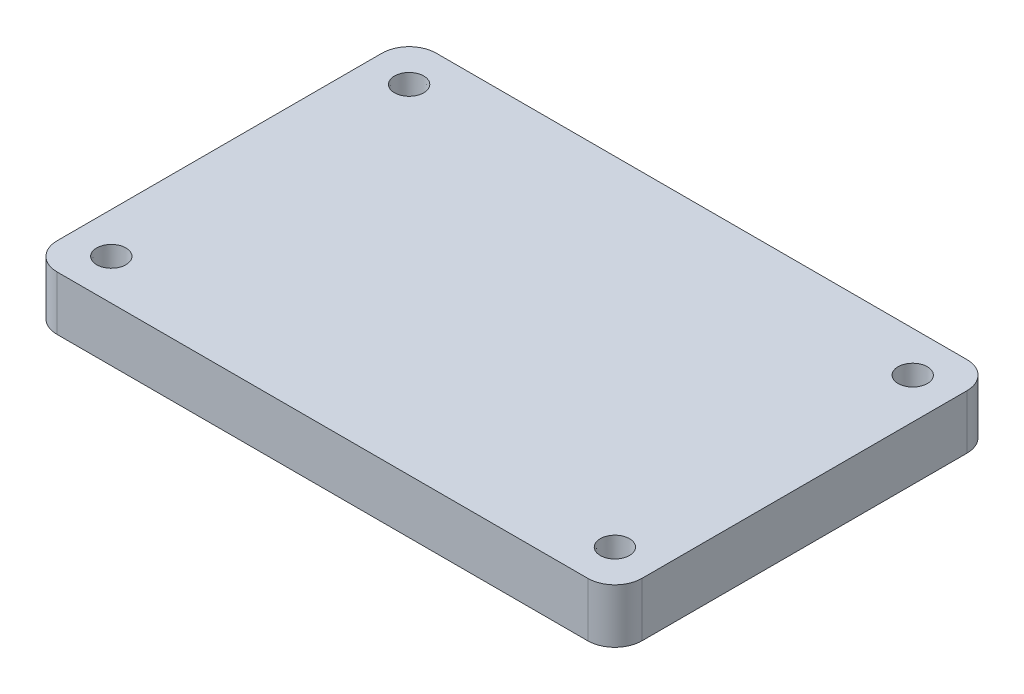
from build123d import *
from OCP.BRepFilletAPI import BRepFilletAPI_MakeChamfer

# Parameters (mm, degrees)
SKETCH1_W           = 108
SKETCH1_H           = 70
BOSS_EXTRUDE1_DEPTH = 10
HOLE1_D             = 4.8
HOLE1_DEPTH         = 8
HOLE1_CBORE_D       = 5.4
HOLE1_CBORE_DEPTH   = 6
FILLET1_R           = 5
HOLE3_D             = 4.8
HOLE3_DEPTH         = 8
HOLE3_CBORE_D       = 5.4
HOLE3_CBORE_DEPTH   = 6
CHAMFER1_SIZE       = 6
CHAMFER1_SIZE_2     = 0.3


with BuildPart() as part:
    # Sketch1 → Boss-Extrude1 (new body)
    with BuildSketch(Plane(origin=(0, 0, 0), x_dir=(1, 0, 0), z_dir=(0, 1, 0))):
        Rectangle(SKETCH1_W, SKETCH1_H)
    extrude(amount=BOSS_EXTRUDE1_DEPTH)

    # Hole1
    with Locations(Plane(origin=(0, 10, 0), x_dir=(1, 0, 0), z_dir=(0, 1, 0))):
        with Locations((46.5, 27.5), (-46.5, 27.5), (-46.5, -27.5), (46.5, -27.5)):
            CounterBoreHole(HOLE1_D / 2, HOLE1_CBORE_D / 2, HOLE1_CBORE_DEPTH, depth=HOLE1_DEPTH)

    # Fillet1
    fillet1_edges = [part.edges().sort_by_distance(p)[0] for p in [
        (54, 5, 35),
        (-54, 5, 35),
        (-54, 5, -35),
        (54, 5, -35),
    ]]
    fillet(fillet1_edges, radius=FILLET1_R)

    # Hole3
    with Locations(Plane(origin=(0, 0, 0), x_dir=(-1, 0, 0), z_dir=(0, -1, 0))):
        with Locations((-20.3, 0), (20.3, 0), (-30, 27.5), (30, 27.5), (30, -27.5), (-30, -27.5)):
            CounterBoreHole(HOLE3_D / 2, HOLE3_CBORE_D / 2, HOLE3_CBORE_DEPTH, depth=HOLE3_DEPTH)

    # Chamfer1
    chamfer1_edges_1 = [part.edges().sort_by_distance(p)[0] for p in [
        (43.8, 4, 27.5),
    ]]
    chamfer1_side_1 = [part.faces().sort_by_distance(p)[0] for p in [
        (43.8, 4.006, 27.5),
    ]]
    chamfer1_edges_2 = [part.edges().sort_by_distance(p)[0] for p in [
        (-49.2, 4, 27.5),
    ]]
    chamfer1_side_2 = [part.faces().sort_by_distance(p)[0] for p in [
        (-49.2, 4.006, 27.5),
    ]]
    chamfer1_edges_3 = [part.edges().sort_by_distance(p)[0] for p in [
        (-49.2, 4, -27.5),
    ]]
    chamfer1_side_3 = [part.faces().sort_by_distance(p)[0] for p in [
        (-49.2, 4.006, -27.5),
    ]]
    chamfer1_edges_4 = [part.edges().sort_by_distance(p)[0] for p in [
        (43.8, 4, -27.5),
    ]]
    chamfer1_side_4 = [part.faces().sort_by_distance(p)[0] for p in [
        (43.8, 4.006, -27.5),
    ]]
    chamfer1_edges_5 = [part.edges().sort_by_distance(p)[0] for p in [
        (32.7, 6, 27.5),
    ]]
    chamfer1_side_5 = [part.faces().sort_by_distance(p)[0] for p in [
        (32.7, 5.994, 27.5),
    ]]
    chamfer1_edges_6 = [part.edges().sort_by_distance(p)[0] for p in [
        (-27.3, 6, 27.5),
    ]]
    chamfer1_side_6 = [part.faces().sort_by_distance(p)[0] for p in [
        (-27.3, 5.994, 27.5),
    ]]
    chamfer1_edges_7 = [part.edges().sort_by_distance(p)[0] for p in [
        (-27.3, 6, -27.5),
    ]]
    chamfer1_side_7 = [part.faces().sort_by_distance(p)[0] for p in [
        (-27.3, 5.994, -27.5),
    ]]
    chamfer1_edges_8 = [part.edges().sort_by_distance(p)[0] for p in [
        (32.7, 6, -27.5),
    ]]
    chamfer1_side_8 = [part.faces().sort_by_distance(p)[0] for p in [
        (32.7, 5.994, -27.5),
    ]]
    chamfer1_edges_9 = [part.edges().sort_by_distance(p)[0] for p in [
        (-17.6, 6, 0),
    ]]
    chamfer1_side_9 = [part.faces().sort_by_distance(p)[0] for p in [
        (-17.6, 5.994, 0),
    ]]
    chamfer1_edges_10 = [part.edges().sort_by_distance(p)[0] for p in [
        (23, 6, 0),
    ]]
    chamfer1_side_10 = [part.faces().sort_by_distance(p)[0] for p in [
        (23, 5.994, 0),
    ]]
    chamfer1 = BRepFilletAPI_MakeChamfer(part.part.solid().wrapped)
    for e in chamfer1_edges_1:
        chamfer1.Add(CHAMFER1_SIZE - 0.0001, CHAMFER1_SIZE_2 - 0.0001, e.wrapped, chamfer1_side_1[0].wrapped)
    for e in chamfer1_edges_2:
        chamfer1.Add(CHAMFER1_SIZE - 0.0001, CHAMFER1_SIZE_2 - 0.0001, e.wrapped, chamfer1_side_2[0].wrapped)
    for e in chamfer1_edges_3:
        chamfer1.Add(CHAMFER1_SIZE - 0.0001, CHAMFER1_SIZE_2 - 0.0001, e.wrapped, chamfer1_side_3[0].wrapped)
    for e in chamfer1_edges_4:
        chamfer1.Add(CHAMFER1_SIZE - 0.0001, CHAMFER1_SIZE_2 - 0.0001, e.wrapped, chamfer1_side_4[0].wrapped)
    for e in chamfer1_edges_5:
        chamfer1.Add(CHAMFER1_SIZE - 0.0001, CHAMFER1_SIZE_2 - 0.0001, e.wrapped, chamfer1_side_5[0].wrapped)
    for e in chamfer1_edges_6:
        chamfer1.Add(CHAMFER1_SIZE - 0.0001, CHAMFER1_SIZE_2 - 0.0001, e.wrapped, chamfer1_side_6[0].wrapped)
    for e in chamfer1_edges_7:
        chamfer1.Add(CHAMFER1_SIZE - 0.0001, CHAMFER1_SIZE_2 - 0.0001, e.wrapped, chamfer1_side_7[0].wrapped)
    for e in chamfer1_edges_8:
        chamfer1.Add(CHAMFER1_SIZE - 0.0001, CHAMFER1_SIZE_2 - 0.0001, e.wrapped, chamfer1_side_8[0].wrapped)
    for e in chamfer1_edges_9:
        chamfer1.Add(CHAMFER1_SIZE - 0.0001, CHAMFER1_SIZE_2 - 0.0001, e.wrapped, chamfer1_side_9[0].wrapped)
    for e in chamfer1_edges_10:
        chamfer1.Add(CHAMFER1_SIZE - 0.0001, CHAMFER1_SIZE_2 - 0.0001, e.wrapped, chamfer1_side_10[0].wrapped)
    add(Compound.cast(chamfer1.Shape()), mode=Mode.REPLACE)  # a hair under: the kernel refuses the full size


solid = part.part
